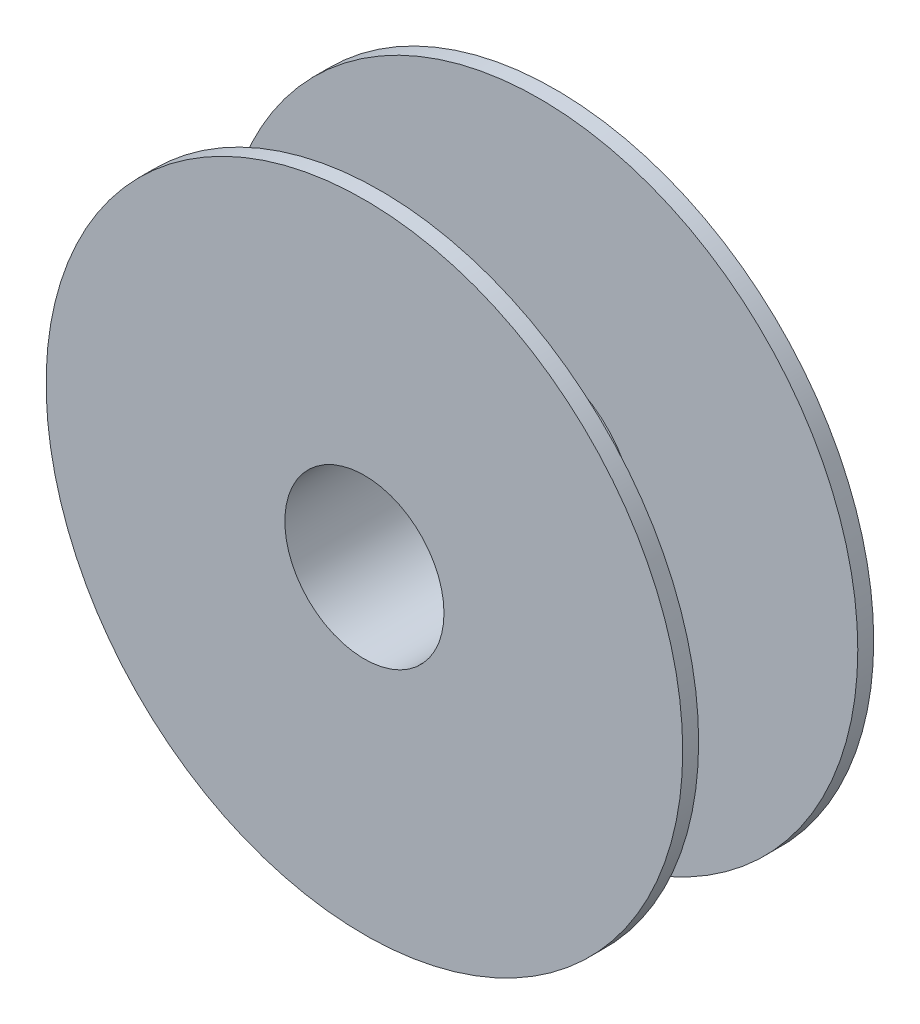
from build123d import *

# Parameters (mm, degrees)
SKETCH1_R           = 100
SKETCH1_R_2         = 25
BOSS_EXTRUDE1_DEPTH = 60
SHELL1_T            = -5


with BuildPart() as part:
    # Sketch1 → Boss-Extrude1 (new body)
    with BuildSketch(Plane.XY):
        Circle(SKETCH1_R)
        Circle(SKETCH1_R_2, mode=Mode.SUBTRACT)
    extrude(amount=BOSS_EXTRUDE1_DEPTH)

    # Shell1
    shell1_openings = [part.faces().sort_by_distance(p)[0] for p in [
        (-100, 0, 30),
    ]]
    offset(amount=SHELL1_T, openings=shell1_openings, kind=Kind.INTERSECTION)


solid = part.part
